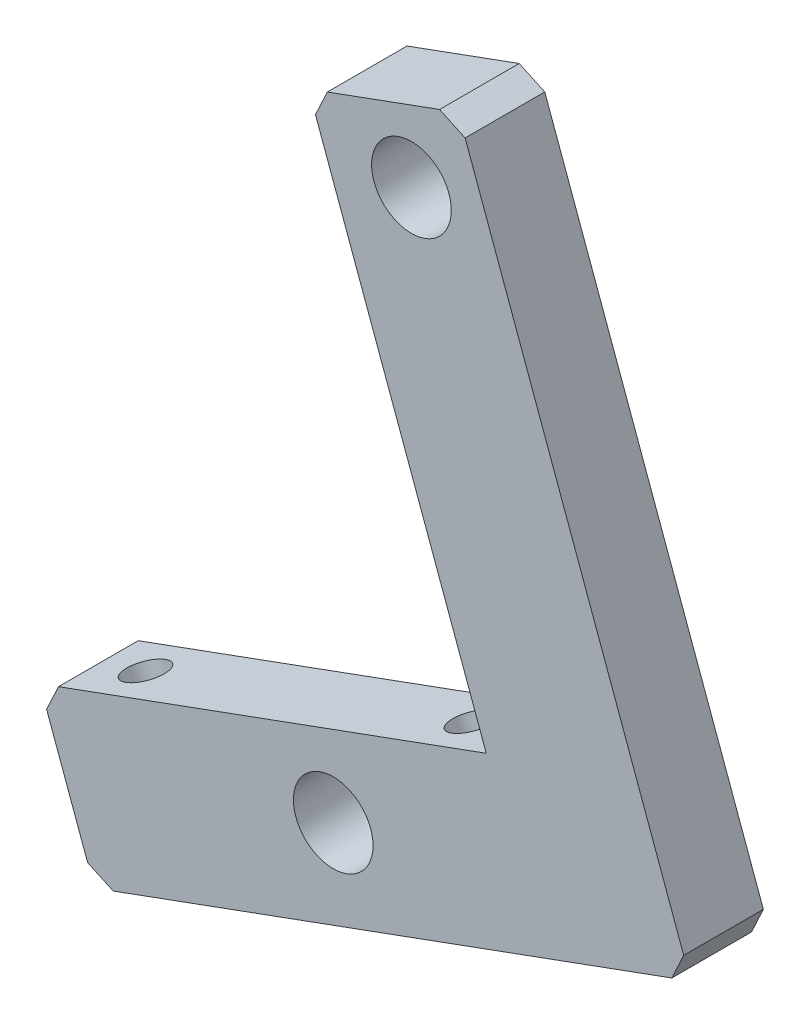
from build123d import *

# Parameters (mm, degrees)
SKETCH_1_R          = 5
EXTRUDE_1_DEPTH     = 10
SKETCH_2_R          = 2.5
CUT_EXTRUDE_2_DEPTH = 113.740370876
CHAMFER_1_SIZE      = 2.5


with BuildPart() as part:
    # 草圖1 → 填料-伸長1 (new body)
    with BuildSketch(Plane.XY):
        Polygon((-29.956118011, 9.755168573), (-48.742646001, 2.894675435), (-26.446043305, -58.161540532), (-82.490240349, -78.627846462), (-75.629747212, -97.414374452), (-0.799022178, -70.087575384), align=None)
        with Locations((-35.835723415, -1.346100652)):
            Circle(SKETCH_1_R, mode=Mode.SUBTRACT)
        with Locations((-45.654562181, -75.31707846)):
            Circle(SKETCH_1_R, mode=Mode.SUBTRACT)
    extrude(amount=EXTRUDE_1_DEPTH)

    # 草圖2 → 除料-伸長2 (cut, through all)
    with BuildSketch(Plane(origin=(15.628555148, -42.796674065, 0), x_dir=(0.9393263994919209, 0.3430246568652819, 0), z_dir=(-0.3430246568652819, 0.939326399491921, 0))):
        with Locations((-95.671540667, -4.982155923)):
            Circle(SKETCH_2_R)
        with Locations((-52.126292594, -4.982155923)):
            Circle(SKETCH_2_R)
    extrude(amount=-CUT_EXTRUDE_2_DEPTH, mode=Mode.SUBTRACT)

    # 導角1
    chamfer_1_edges = [part.edges().sort_by_distance(p)[0] for p in [
        (-29.956118011, 9.755168573, 5),
        (-48.742646001, 2.894675435, 5),
        (-0.799022178, -70.087575384, 5),
        (-75.629747212, -97.414374452, 5),
        (-82.490240349, -78.627846462, 5),
    ]]
    chamfer(chamfer_1_edges, length=CHAMFER_1_SIZE)


solid = part.part
